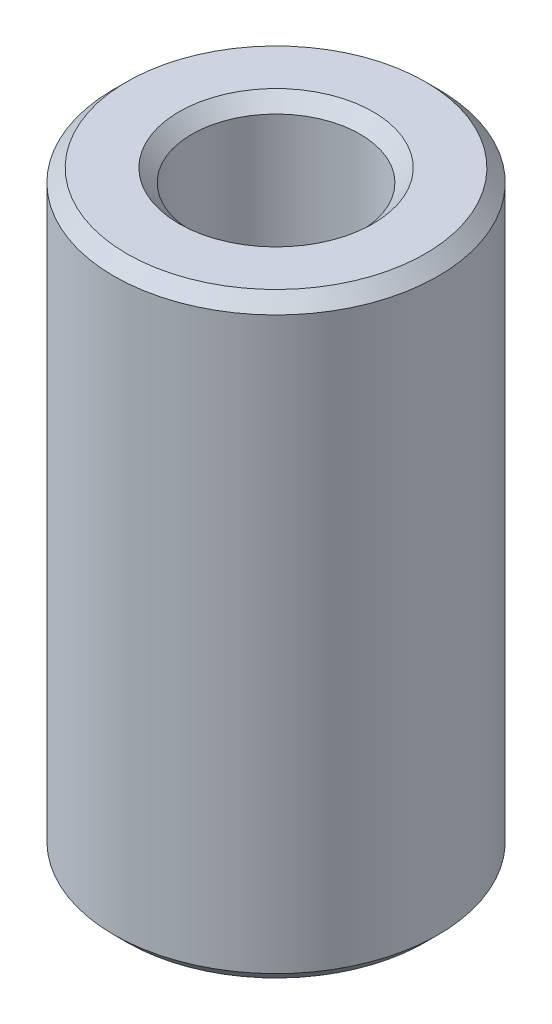
from build123d import *

# Parameters (mm, degrees)
SKETCH1_R           = 50
BOSS_EXTRUDE1_DEPTH = 183.973604109
SKETCH2_R           = 25.945950382
CUT_EXTRUDE1_DEPTH  = 198.094614357
CHAMFER1_SIZE       = 3.990246275


with BuildPart() as part:
    # Sketch1 → Boss-Extrude1 (new body)
    with BuildSketch(Plane(origin=(0, 0, 0), x_dir=(1, 0, 0), z_dir=(0, 1, 0))):
        Circle(SKETCH1_R)
    extrude(amount=BOSS_EXTRUDE1_DEPTH)

    # Sketch2 → Cut-Extrude1 (cut, through all)
    with BuildSketch(Plane(origin=(0, 0, 0), x_dir=(1, 0, 0), z_dir=(0, 1, 0))):
        Circle(SKETCH2_R)
    extrude(amount=CUT_EXTRUDE1_DEPTH, mode=Mode.SUBTRACT)

    # Chamfer1
    chamfer1_edges = [part.edges().sort_by_distance(p)[0] for p in [
        (-25.945950382, 183.973604109, 0),
        (-25.945950382, 0, 0),
        (-50, 0, 0),
        (-50, 183.973604109, 0),
    ]]
    chamfer(chamfer1_edges, length=CHAMFER1_SIZE)


solid = part.part
